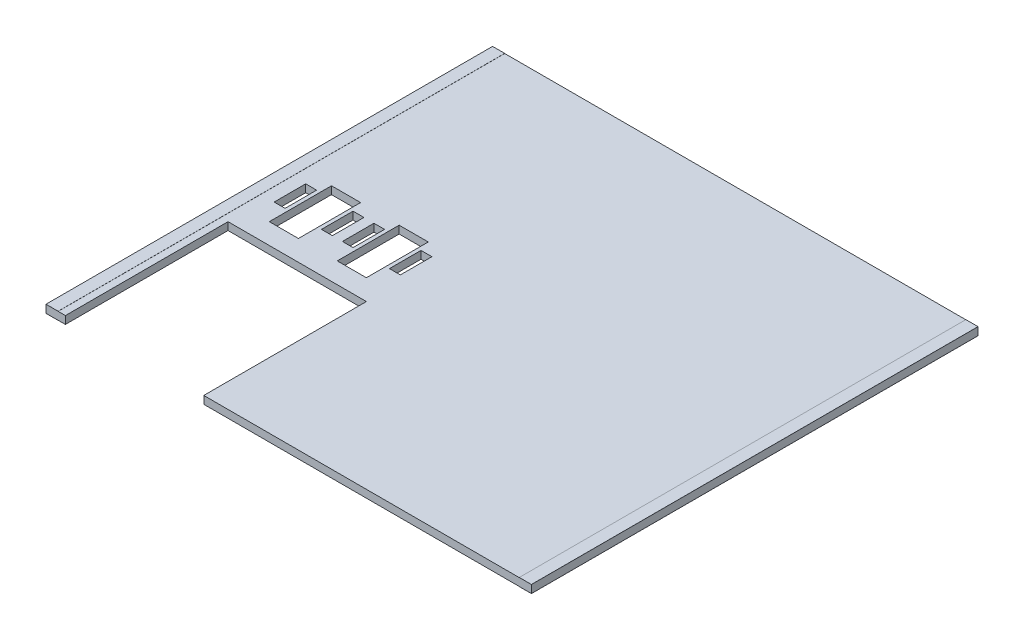
from build123d import *

# Parameters (mm, degrees)
BOSS_EXTRUDE1_DEPTH   = 1.5875
SKETCH3_W             = 2.5
SKETCH3_H             = 92
BOSS_EXTRUDE2_DEPTH   = 0.025
BOSS_EXTRUDE2_2_DEPTH = 0.025
SKETCH5_W             = 2.5
SKETCH5_H             = 92
BOSS_EXTRUDE3_DEPTH   = 0.025
BOSS_EXTRUDE3_2_DEPTH = 0.025
SKETCH6_W             = 6
SKETCH6_H             = 12.75
SKETCH6_H_2           = 12.8125
SKETCH6_W_2           = 2.25
SKETCH6_H_3           = 6.5
SKETCH6_W_3           = 2.1875
CUT_EXTRUDE1_DEPTH    = 129.699650956


with BuildPart() as part:
    # Sketch1 → Boss-Extrude1 (new body)
    with BuildSketch(Plane(origin=(0, 0, 0), x_dir=(1, 0, 0), z_dir=(0, 1, 0))):
        Polygon((0, -11), (4, -11), (4, 22.5), (32.5, 22.5), (32.5, -11), (100, -11), (100, 81), (0, 81), align=None)
    extrude(amount=BOSS_EXTRUDE1_DEPTH)

    # Sketch6 → Cut-Extrude1 (cut, through all)
    with BuildSketch(Plane(origin=(0, 1.5875, 0), x_dir=(1, 0, 0), z_dir=(0, 1, 0))):
        with Locations((25.25, 33.125)):
            Rectangle(SKETCH6_W, SKETCH6_H)
        with Locations((11.25, 33.15625)):
            Rectangle(SKETCH6_W, SKETCH6_H_2)
        with Locations((16.125, 34)):
            Rectangle(SKETCH6_W_2, SKETCH6_H_3)
        with Locations((6.375, 34)):
            Rectangle(SKETCH6_W_2, SKETCH6_H_3)
        with Locations((20.40625, 34)):
            Rectangle(SKETCH6_W_3, SKETCH6_H_3)
        with Locations((30.125, 34)):
            Rectangle(SKETCH6_W_2, SKETCH6_H_3)
    extrude(amount=-CUT_EXTRUDE1_DEPTH, mode=Mode.SUBTRACT)


with BuildPart() as body_2:
    # Sketch3 → Boss-Extrude2 (new body)
    with BuildSketch(Plane(origin=(0, 1.5875, 0), x_dir=(1, 0, 0), z_dir=(0, 1, 0))):
        with Locations((1.25, 35)):
            Rectangle(SKETCH3_W, SKETCH3_H)
    extrude(amount=BOSS_EXTRUDE2_DEPTH)


with BuildPart() as body_3:
    # Sketch3 → Boss-Extrude2 2 (new body)
    with BuildSketch(Plane(origin=(0, 1.5875, 0), x_dir=(1, 0, 0), z_dir=(0, 1, 0))):
        with Locations((98.75, 35)):
            Rectangle(SKETCH3_W, SKETCH3_H)
    extrude(amount=BOSS_EXTRUDE2_2_DEPTH)


with BuildPart() as body_4:
    # Sketch5 → Boss-Extrude3 (new body)
    with BuildSketch(Plane.XZ):
        with Locations((1.25, -35)):
            Rectangle(SKETCH5_W, SKETCH5_H)
    extrude(amount=BOSS_EXTRUDE3_DEPTH)


with BuildPart() as body_5:
    # Sketch5 → Boss-Extrude3 2 (new body)
    with BuildSketch(Plane.XZ):
        with Locations((98.75, -35)):
            Rectangle(SKETCH5_W, SKETCH5_H)
    extrude(amount=BOSS_EXTRUDE3_2_DEPTH)


solid = Compound([part.part, body_2.part, body_3.part, body_4.part, body_5.part])
